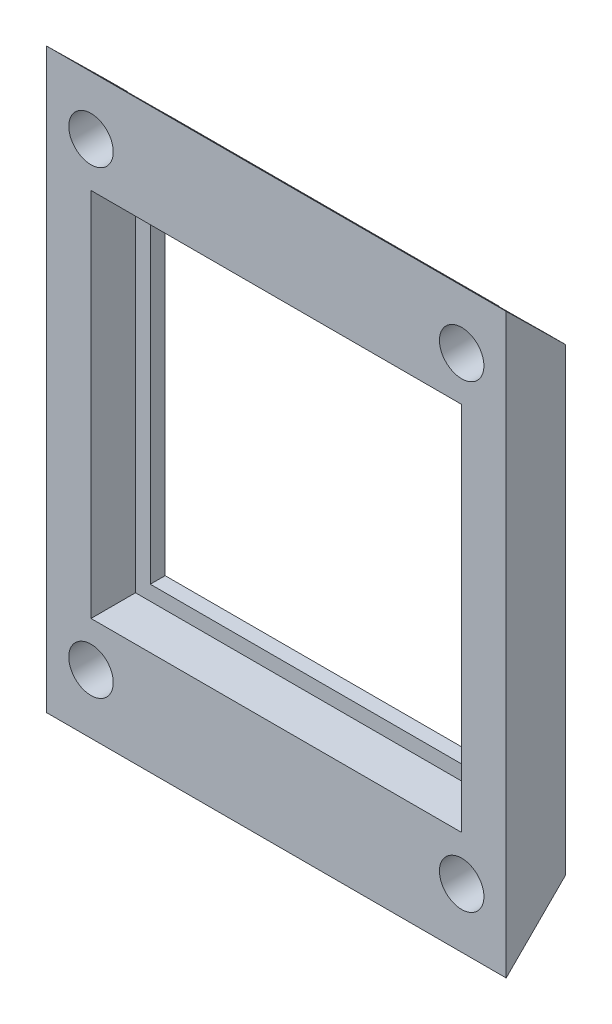
from build123d import *

# Parameters (mm, degrees)
SKETCH3_W               = 31
SKETCH3_H               = 31
BOSS_EXTRUDE2_DEPTH     = 4
SKETCH4_W               = 25
SKETCH4_H               = 25
CUT_EXTRUDE1_DEPTH      = 3
SKETCH5_W               = 23
SKETCH5_H               = 23
CUT_EXTRUDE2_DEPTH      = 5
SKETCH9_R               = 1.5
CUT_EXTRUDE3_DEPTH      = 10
MIRROR3_COPY_1_SKETCH_R = 1.5
MIRROR3_COPY_1_DEPTH    = 10
MIRROR3_COPY_2_SKETCH_R = 1.5
MIRROR3_COPY_2_DEPTH    = 10


with BuildPart() as part:
    # Sketch3 → Boss-Extrude2 (new body)
    with BuildSketch(Plane.XY):
        Rectangle(SKETCH3_W, SKETCH3_H)
    extrude(amount=BOSS_EXTRUDE2_DEPTH)

    # Sketch4 → Cut-Extrude1 (cut)
    with BuildSketch(Plane.XY.offset(4)):
        Rectangle(SKETCH4_W, SKETCH4_H)
    extrude(amount=-CUT_EXTRUDE1_DEPTH, mode=Mode.SUBTRACT)

    # Sketch5 → Cut-Extrude2 (cut)
    with BuildSketch(Plane.XY.offset(1)):
        Rectangle(SKETCH5_W, SKETCH5_H)
    extrude(amount=-CUT_EXTRUDE2_DEPTH, mode=Mode.SUBTRACT)

    # Sweep1: sweep along a curve in space
    with BuildLine() as sweep1_path:
        Line((-15.5, -15.5, 4), (15.5, -15.5, 4))
    # Sketch6 → Sweep1 (sweep)
    with BuildSketch(Plane.ZY.offset(15.5)):
        Polygon((4, -15.5), (4, -19.5), (0, -15.5), align=None)
    sweep(path=sweep1_path.line)

    # Sweep2: sweep along a curve in space
    with BuildLine() as sweep2_path:
        Line((15.5, 15.5, 0), (-15.5, 15.5, 0))
    # Sketch8 → Sweep2 (sweep)
    with BuildSketch(Plane.ZY.offset(15.5)):
        Polygon((0, 15.5), (4, 19.43634716), (4, 15.5), align=None)
    sweep(path=sweep2_path.line)

    # Sketch9 → Cut-Extrude3 (cut)
    with BuildSketch(Plane(origin=(0, 0, 0), x_dir=(-1, 0, 0), z_dir=(0, 0, -1))):
        with Locations((-12.5, 15.5)):
            Circle(SKETCH9_R)
    cut_extrude3 = extrude(amount=-CUT_EXTRUDE3_DEPTH, mode=Mode.SUBTRACT)

    # Mirror1: Cut-Extrude3 across plane
    add(cut_extrude3.mirror(Plane(origin=(0, 0, 0), x_dir=(0, 0, 1), z_dir=(1, 0, 0))), mode=Mode.SUBTRACT)

    # Mirror3 copy 1 sketch → Mirror3 copy 1 (cut)
    with BuildSketch(Plane(origin=(0, 0, 0), x_dir=(1, 0, 0), z_dir=(0, 0, -1))):
        with Locations((-12.5, 15.5)):
            Circle(MIRROR3_COPY_1_SKETCH_R)
    extrude(amount=-MIRROR3_COPY_1_DEPTH, mode=Mode.SUBTRACT)

    # Mirror3 copy 2 sketch → Mirror3 copy 2 (cut)
    with BuildSketch(Plane(origin=(0, 0, 0), x_dir=(-1, 0, 0), z_dir=(0, 0, -1))):
        with Locations((-12.5, -15.5)):
            Circle(MIRROR3_COPY_2_SKETCH_R)
    extrude(amount=-MIRROR3_COPY_2_DEPTH, mode=Mode.SUBTRACT)


solid = part.part
